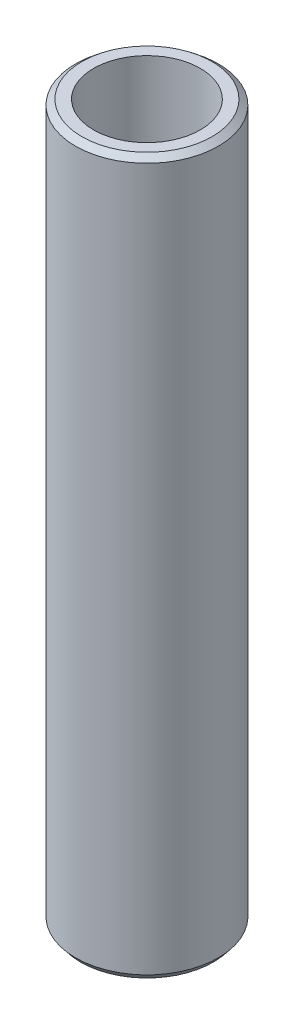
from build123d import *
from OCP.BRepFilletAPI import BRepFilletAPI_MakeChamfer

# Parameters (mm, degrees)
SKETCH1_R           = 55
BOSS_EXTRUDE1_DEPTH = 550.169340755
SKETCH2_R           = 41.08964353
CUT_EXTRUDE1_DEPTH  = 556.640444448
CHAMFER1_SIZE       = 3.913862295
CHAMFER1_SIZE2      = 4.860343478


with BuildPart() as part:
    # Sketch1 → Boss-Extrude1 (new body)
    with BuildSketch(Plane(origin=(0, 0, 0), x_dir=(1, 0, 0), z_dir=(0, 1, 0))):
        Circle(SKETCH1_R)
    extrude(amount=BOSS_EXTRUDE1_DEPTH)

    # Sketch2 → Cut-Extrude1 (cut, through all)
    with BuildSketch(Plane(origin=(0, 0, 0), x_dir=(1, 0, 0), z_dir=(0, 1, 0))):
        Circle(SKETCH2_R)
    extrude(amount=CUT_EXTRUDE1_DEPTH, mode=Mode.SUBTRACT)

    # Chamfer1: one chamfer whose edges measure the first distance from different faces: ONE call of the kernel's chamfer builder (chamfer() names one face for all edges)
    chamfer1_edges_1 = [part.edges().sort_by_distance(p)[0] for p in [
        (-55, 550.169340755, 0),
    ]]
    chamfer1_side_1 = [part.faces().sort_by_distance(p)[0] for p in [
        (-55, 275.084670377, 0),
    ]]
    chamfer1_edges_2 = [part.edges().sort_by_distance(p)[0] for p in [
        (-55, 0, 0),
    ]]
    chamfer1_side_2 = [part.faces().sort_by_distance(p)[0] for p in [
        (-53.444365081, 0, 0),
    ]]
    chamfer1 = BRepFilletAPI_MakeChamfer(part.part.solid().wrapped)
    for e in chamfer1_edges_1:
        chamfer1.Add(CHAMFER1_SIZE, CHAMFER1_SIZE2, e.wrapped, chamfer1_side_1[0].wrapped)  # the first distance lies on this face
    for e in chamfer1_edges_2:
        chamfer1.Add(CHAMFER1_SIZE, CHAMFER1_SIZE2, e.wrapped, chamfer1_side_2[0].wrapped)  # the first distance lies on this face
    add(Compound.cast(chamfer1.Shape()), mode=Mode.REPLACE)


solid = part.part
